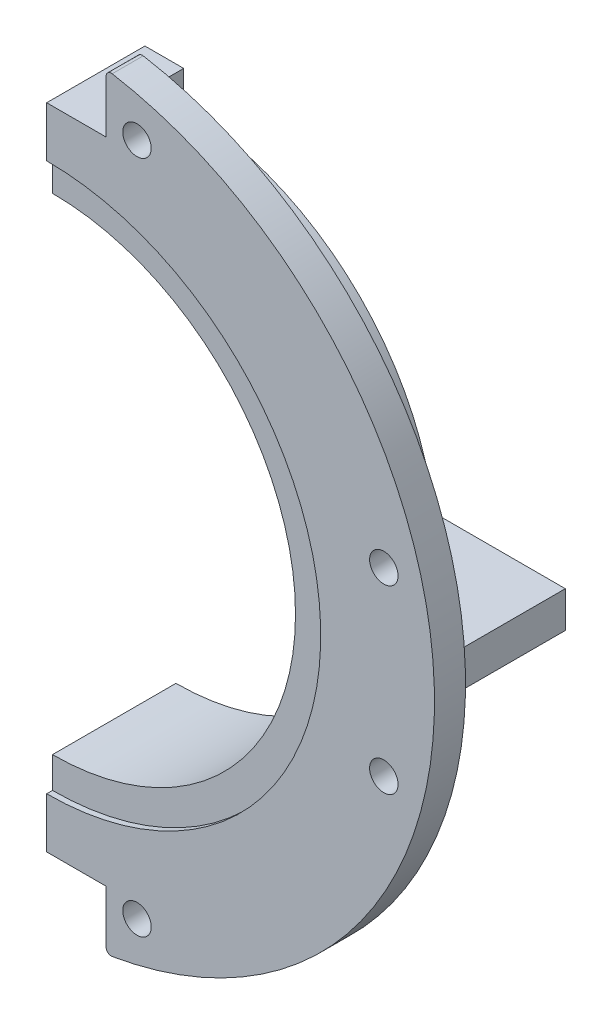
from build123d import *

# Parameters (mm, degrees)
SKETCH1_W                = 180
SKETCH1_H                = 180
BOSS_EXTRUDE1_DEPTH      = 6
SKETCH2_R                = 50.3
SKETCH2_R_2              = 46.3
BOSS_EXTRUDE2_DEPTH      = 19
CUT_EXTRUDE1_DEPTH       = 256.266527379
CUT_EXTRUDE1_DEPTH_BACK  = 256.266527379
SKETCH3_R                = 47
BOSS_EXTRUDE3_DEPTH      = 60
FILLET4_R                = 3
M5_CLEARANCE_HOLE1_D     = 5.5
SKETCH15_W               = 25
SKETCH15_H               = 7
BOSS_EXTRUDE5_DEPTH      = 19
CUT_EXTRUDE3_DEPTH       = 2
FILLET5_R                = 1.5
CUT_EXTRUDE4_REACH       = 264.975
CUT_EXTRUDE5_REACH       = 244.499
SKETCH33_W               = 1
SKETCH33_H               = 25
SKETCH35_W               = 15
SKETCH35_H               = 13
BOSS_EXTRUDE6_DEPTH      = 13
M5_CLEARANCE_HOLE2_D     = 5.5
CUT_EXTRUDE6_DEPTH       = 4.2
CUT_EXTRUDE7_REACH       = 242.936
SKETCH41_W               = 23
SKETCH41_H               = 15
FILLET8_R                = 1
CUT_EXTRUDE8_REACH       = 197.694
SKETCH47_R               = 53
CUT_EXTRUDE10_DEPTH      = 1.12
CUT_EXTRUDE12_DEPTH      = 238.295626108
CUT_EXTRUDE12_DEPTH_BACK = 238.295626108
SKETCH51_W               = 150
SKETCH51_H               = 200
SKETCH52_W               = 25
SKETCH52_H               = 7
SKETCH52_W_2             = 23
SKETCH52_H_2             = 5
BOSS_EXTRUDE9_DEPTH      = 3
CHAMFER1_SIZE            = 1


with BuildPart() as part:
    # Sketch1 → Boss-Extrude1 (new body)
    with BuildSketch(Plane.XY):
        with Locations((90, 90)):
            Rectangle(SKETCH1_W, SKETCH1_H)
    extrude(amount=BOSS_EXTRUDE1_DEPTH)

    # Sketch2 → Boss-Extrude2 (add)
    with BuildSketch(Plane(origin=(0, 0, 0), x_dir=(-1, 0, 0), z_dir=(0, 0, -1))):
        with Locations((-90, 90)):
            Circle(SKETCH2_R)
        with Locations((-90, 90)):
            Circle(SKETCH2_R_2, mode=Mode.SUBTRACT)
    extrude(amount=BOSS_EXTRUDE2_DEPTH)

    # Sketch3 → Cut-Extrude1 (cut, two sides: drawn at the far end of the back side and taken through both)
    with BuildSketch(Plane(origin=(0, 0, 0), x_dir=(-1, 0, 0), z_dir=(0, 0, -1)).offset(-CUT_EXTRUDE1_DEPTH_BACK)):
        with Locations((-90, 90)):
            Circle(SKETCH3_R)
    extrude(amount=CUT_EXTRUDE1_DEPTH + CUT_EXTRUDE1_DEPTH_BACK, mode=Mode.SUBTRACT)

    # Sketch4 → Boss-Extrude3 (add)
    with BuildSketch(Plane(origin=(0, 0, 0), x_dir=(-1, 0, 0), z_dir=(0, 0, -1))):
        with BuildLine():
            Line((0, 77.5), (0, 102.5))
            Line((0, 102.5), (-41.277931078, 102.5))
            ThreePointArc((-41.277931078, 102.5), (-39.7, 90), (-41.277931078, 77.5))
            Line((-41.277931078, 77.5), (0, 77.5))
        make_face()
    extrude(amount=BOSS_EXTRUDE3_DEPTH)

    # Fillet4
    fillet4_edges = [part.edges().sort_by_distance(p)[0] for p in [
        (41.277931078, 102.5, -9.5),
        (41.277931078, 77.5, -9.5),
    ]]
    fillet(fillet4_edges, radius=FILLET4_R)

    # M5 Clearance Hole1 (through all)
    with Locations(Plane(origin=(0, 0, 0), x_dir=(-1, 0, 0), z_dir=(0, 0, -1))):
        with Locations((-107.470285544, 155.199993275), (-155.199993275, 107.470285544), (-155.199993275, 72.529714456), (-107.470285544, 24.800006725), (-72.529714456, 24.800006725), (-24.800006725, 72.529714456), (-24.800006725, 107.470285544), (-72.529714456, 155.199993275)):
            Hole(M5_CLEARANCE_HOLE1_D / 2)

    # Sketch15 → Boss-Extrude5 (add)
    with BuildSketch(Plane(origin=(0, 0, 0), x_dir=(-1, 0, 0), z_dir=(0, 0, -1))):
        with Locations((-149.8, 90)):
            Rectangle(SKETCH15_W, SKETCH15_H)
    extrude(amount=BOSS_EXTRUDE5_DEPTH)

    # Sketch17 → Cut-Extrude3 (cut, symmetric)
    with BuildSketch(Plane(origin=(0, 90, 0), x_dir=(0, 0, -1), z_dir=(0, 1, 0))):
        Polygon((19, -154.732971354), (-1.044131231, -134.688840123), (-5.544131231, -134.688840123), (19, -159.232971354), align=None)
        Polygon((-5.544131231, -134.688840123), (-1.044131231, -134.688840123), (19, -154.732971354), (19, -159.232971354), align=None)
    extrude(amount=CUT_EXTRUDE3_DEPTH, both=True, mode=Mode.SUBTRACT)

    # Fillet5
    fillet5_edges = [part.edges().sort_by_distance(p)[0] for p in [
        (145.845199441, 92, -10.112228087),
        (145.845199441, 88, -10.112228087),
        (148.095199441, 92, -7.862228087),
        (148.095199441, 88, -7.862228087),
    ]]
    fillet(fillet5_edges, radius=FILLET5_R)

    # Sketch31 → Cut-Extrude4 (cut, up to next)
    with BuildSketch(Plane.XY.offset(6), mode=Mode.PRIVATE) as cut_extrude4_sk1:
        with BuildLine():
            Line((0, 180), (0, 102.5))
            Line((0, 102.5), (16.049002711, 102.5))
            ThreePointArc((16.049002711, 102.5), (165, 90), (16.049002711, 77.5))
            Line((16.049002711, 77.5), (0, 77.5))
            Line((0, 77.5), (0, 0))
            Line((0, 0), (180, 0))
            Line((180, 0), (180, 180))
            Line((180, 180), (0, 180))
        make_face()
    cut_extrude4_tool1 = extrude(cut_extrude4_sk1.sketch, amount=-CUT_EXTRUDE4_REACH, mode=Mode.PRIVATE) & part.part
    add(cut_extrude4_tool1.solids().sort_by_distance((2.545584, 141.25, 6))[0], mode=Mode.SUBTRACT)

    # Sketch33 → Cut-Extrude5 (cut, up to next)
    with BuildSketch(Plane.XY.offset(6), mode=Mode.PRIVATE) as cut_extrude5_sk1:
        with Locations((0.5, 90)):
            Rectangle(SKETCH33_W, SKETCH33_H)
    cut_extrude5_tool1 = extrude(cut_extrude5_sk1.sketch, amount=-CUT_EXTRUDE5_REACH, mode=Mode.PRIVATE) & part.part
    add(cut_extrude5_tool1.solids().sort_by_distance((0.5, 90, 6))[0], mode=Mode.SUBTRACT)

    # Sketch35 → Boss-Extrude6 (add)
    with BuildSketch(Plane(origin=(0, 0, 0), x_dir=(-1, 0, 0), z_dir=(0, 0, -1))):
        with Locations((-90, 146.23771205)):
            Rectangle(SKETCH35_W, SKETCH35_H)
        with Locations((-90, 33.76228795)):
            Rectangle(SKETCH35_W, SKETCH35_H)
    extrude(amount=BOSS_EXTRUDE6_DEPTH)

    # M5 Clearance Hole2 (through all)
    with Locations(Plane(origin=(97.5, 0, 0), x_dir=(0, 0, -1), z_dir=(1, 0, 0))):
        with Locations((6.5, 146.23771205), (6.5, 33.76228795)):
            Hole(M5_CLEARANCE_HOLE2_D / 2)

    # Sketch40 → Cut-Extrude6 (cut)
    with BuildSketch(Plane.ZY.offset(-82.5)):
        Polygon((-10.75, 143.783973406), (-6.5, 141.330234762), (-2.25, 143.783973406), (-2.25, 148.691450694), (-6.5, 151.145189338), (-10.75, 148.691450694), align=None)
        Polygon((-2.25, 31.308549306), (-2.25, 36.216026594), (-6.5, 38.669765238), (-10.75, 36.216026594), (-10.75, 31.308549306), (-6.5, 28.854810662), align=None)
    extrude(amount=-CUT_EXTRUDE6_DEPTH, mode=Mode.SUBTRACT)

    # Sketch41 → Cut-Extrude7 (cut, up to next)
    with BuildSketch(Plane(origin=(0, 0, 0), x_dir=(-1, 0, 0), z_dir=(0, 0, -1)), mode=Mode.PRIVATE) as cut_extrude7_sk1:
        with Locations((-90, 160.23771205)):
            Rectangle(SKETCH41_W, SKETCH41_H)
    cut_extrude7_tool1 = extrude(cut_extrude7_sk1.sketch, amount=-CUT_EXTRUDE7_REACH, mode=Mode.PRIVATE) & part.part
    # Sketch41 → Cut-Extrude7 (cut, up to next)
    with BuildSketch(Plane(origin=(0, 0, 0), x_dir=(-1, 0, 0), z_dir=(0, 0, -1)), mode=Mode.PRIVATE) as cut_extrude7_sk2:
        with Locations((-90, 19.76228795)):
            Rectangle(SKETCH41_W, SKETCH41_H)
    cut_extrude7_tool2 = extrude(cut_extrude7_sk2.sketch, amount=-CUT_EXTRUDE7_REACH, mode=Mode.PRIVATE) & part.part
    add(cut_extrude7_tool1.solids().sort_by_distance((90, 160.237712, 0))[0], mode=Mode.SUBTRACT)
    add(cut_extrude7_tool2.solids().sort_by_distance((90, 19.762288, 0))[0], mode=Mode.SUBTRACT)

    # Fillet8
    fillet8_edges = [part.edges().sort_by_distance(p)[0] for p in [
        (101.5, 164.113089262, 3),
        (78.5, 164.113089262, 3),
        (78.5, 15.886910738, 3),
        (101.5, 15.886910738, 3),
    ]]
    fillet(fillet8_edges, radius=FILLET8_R)

    # Sketch42 → Cut-Extrude8 (cut, up to next)
    with BuildSketch(Plane(origin=(0, 102.5, 0), x_dir=(1, 0, 0), z_dir=(0, 1, 0)), mode=Mode.PRIVATE) as cut_extrude8_sk1:
        Polygon((15, -6), (1, 24), (1, -6), align=None)
    cut_extrude8_tool1 = extrude(cut_extrude8_sk1.sketch, amount=-CUT_EXTRUDE8_REACH, mode=Mode.PRIVATE) & part.part
    add(cut_extrude8_tool1.solids().sort_by_distance((5.666667, 102.5, -4))[0], mode=Mode.SUBTRACT)

    # Sketch47 → Cut-Extrude10 (cut)
    with BuildSketch(Plane.XY.offset(6)):
        with Locations((90, 90)):
            Circle(SKETCH47_R)
    extrude(amount=-CUT_EXTRUDE10_DEPTH, mode=Mode.SUBTRACT)

    # Sketch51 → Cut-Extrude12 (cut, two sides: drawn at the far end of the back side and taken through both)
    with BuildSketch(Plane(origin=(0, 0, -13), x_dir=(-1, 0, 0), z_dir=(0, 0, -1)).offset(-CUT_EXTRUDE12_DEPTH_BACK)):
        with Locations((-15, 90)):
            Rectangle(SKETCH51_W, SKETCH51_H)
    extrude(amount=CUT_EXTRUDE12_DEPTH + CUT_EXTRUDE12_DEPTH_BACK, mode=Mode.SUBTRACT)

    # Sketch52 → Boss-Extrude9 (add)
    with BuildSketch(Plane(origin=(0, 0, -19), x_dir=(-1, 0, 0), z_dir=(0, 0, -1))):
        with Locations((-149.8, 90)):
            Rectangle(SKETCH52_W, SKETCH52_H)
        with Locations((-149.8, 90)):
            Rectangle(SKETCH52_W_2, SKETCH52_H_2, mode=Mode.SUBTRACT)
    extrude(amount=BOSS_EXTRUDE9_DEPTH)

    # Chamfer1
    chamfer1_edges = [part.edges().sort_by_distance(p)[0] for p in [
        (161.3, 90, -22),
        (149.8, 87.5, -22),
        (138.3, 90, -22),
        (149.8, 92.5, -22),
    ]]
    chamfer(chamfer1_edges, length=CHAMFER1_SIZE - 0.0001)  # a hair under: the kernel refuses the full size


solid = part.part
